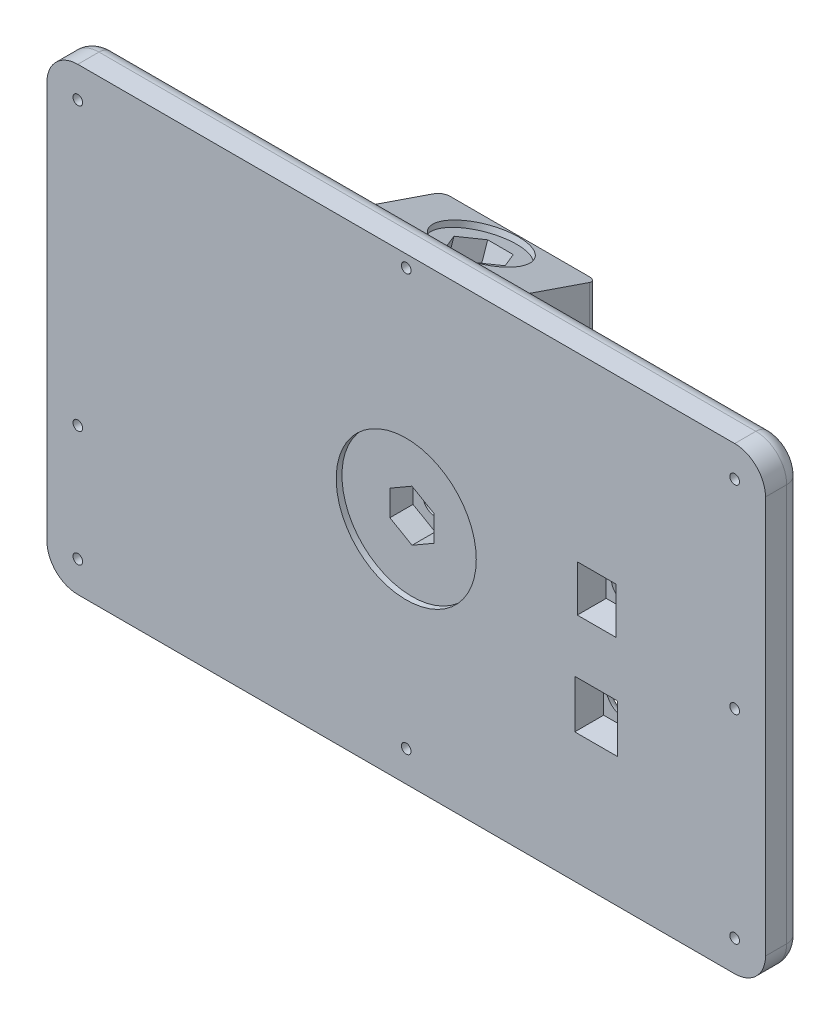
from build123d import *

# Parameters (mm, degrees)
SKETCH1_R            = 1.25
SKETCH1_W            = 156.43
SKETCH1_H            = 89.15
SKETCH1_W_2          = 17.19
SKETCH1_H_2          = 1
SKETCH1_H_3          = 0.5
SKETCH1_W_3          = 1
SKETCH1_H_4          = 11.97
SKETCH1_W_4          = 0.5
SKETCH1_W_5          = 2
BOSS_EXTRUDE3_DEPTH  = 9.5
FILLET2_R            = 4
SKETCH9_R            = 5.06
CUT_EXTRUDE5_DEPTH   = 118.948373888
SKETCH9_3_W          = 11.15
SKETCH9_3_H          = 12.5
CUT_EXTRUDE6_DEPTH   = 7.5
SKETCH10_R           = 3.69
SKETCH10_R_2         = 3.19
CUT_EXTRUDE7_DEPTH   = 118.948373888
SKETCH10_3_W         = 10.01
SKETCH10_3_H         = 11.98
SKETCH10_3_W_2       = 9.01
SKETCH10_3_H_2       = 10.98
SKETCH10_3_R         = 3.69
CUT_EXTRUDE8_DEPTH   = 7.5
FILLET3_R            = 2
SKETCH12_R           = 3.175
CUT_EXTRUDE9_DEPTH   = 118.948373888
SKETCH12_3_R         = 3.175
CUT_EXTRUDE10_DEPTH  = 7.5
SKETCH12_4_R         = 18.175
CUT_EXTRUDE11_DEPTH  = 1.5
SKETCH13_W           = 40
SKETCH13_H           = 25
BOSS_EXTRUDE10_DEPTH = 20
CUT_EXTRUDE12_DEPTH  = 132.946470296
SKETCH15_R           = 10.175
SKETCH15_R_2         = 3.175
CUT_EXTRUDE13_DEPTH  = 1.5
CUT_EXTRUDE14_START  = -1.5
SKETCH15_3_R         = 3.175
CUT_EXTRUDE14_DEPTH  = 6
CUT_EXTRUDE15_START  = -7.5
SKETCH15_5_R         = 3.175
CUT_EXTRUDE15_DEPTH  = 4
SKETCH16_R           = 1.25
CUT_EXTRUDE16_DEPTH  = 122.209813559
FILLET4_R            = 2


# Some blends are built 0.0001 mm under size
with BuildPart() as part:
    # Sketch1 → Boss-Extrude3 (new body)
    # profile 1 of 11: a face of its own
    with BuildSketch(Plane.XY):
        with BuildLine():
            ThreePointArc((-90.129170507, 54.402530662), (-95.786024756, 52.059384912), (-98.129170507, 46.402530662))
            Line((-98.129170507, 46.402530662), (-98.129170507, -56.747469338))
            ThreePointArc((-98.129170507, -56.747469338), (-95.786024756, -62.404323587), (-90.129170507, -64.747469338))
            Line((-90.129170507, -64.747469338), (80.300829493, -64.747469338))
            ThreePointArc((80.300829493, -64.747469338), (85.957683743, -62.404323587), (88.300829493, -56.747469338))
            Line((88.300829493, -56.747469338), (88.300829493, 46.402530662))
            ThreePointArc((88.300829493, 46.402530662), (85.957683743, 52.059384912), (80.300829493, 54.402530662))
            Line((80.300829493, 54.402530662), (-90.129170507, 54.402530662))
        make_face()
        with Locations((-90.129170507, -56.747469338)):
            Circle(SKETCH1_R, mode=Mode.SUBTRACT)
        with Locations((80.300829493, -56.747469338)):
            Circle(SKETCH1_R, mode=Mode.SUBTRACT)
        with BuildLine():
            Line((-89.239170507, -53.907469338), (-89.239170507, 45.524806332))
            ThreePointArc((-89.239170507, 45.524806332), (-91.378326538, 46.448456797), (-89.177120088, 47.212530662))
            Line((-89.177120088, 47.212530662), (-38.909170507, 47.212530662))
            Line((-38.909170507, 47.212530662), (-38.909170507, 48.212530662))
            Line((-38.909170507, 48.212530662), (-21.719170507, 48.212530662))
            Line((-21.719170507, 48.212530662), (-21.719170507, 47.212530662))
            Line((-21.719170507, 47.212530662), (76.680829493, 47.212530662))
            Line((76.680829493, 47.212530662), (76.680829493, -0.147469338))
            Line((76.680829493, -0.147469338), (77.680829493, -0.147469338))
            Line((77.680829493, -0.147469338), (77.680829493, -12.117469338))
            Line((77.680829493, -12.117469338), (76.680829493, -12.117469338))
            Line((76.680829493, -12.117469338), (76.680829493, -53.907469338))
            Line((76.680829493, -53.907469338), (-89.239170507, -53.907469338))
        make_face(mode=Mode.SUBTRACT)
        with Locations((80.300829493, 46.402530662)):
            Circle(SKETCH1_R, mode=Mode.SUBTRACT)
    # profile 2 of 11: a face of its own
    with BuildSketch(Plane.XY):
        with BuildLine():
            ThreePointArc((-88.879170507, 46.402530662), (-88.972667156, 45.928189013), (-89.239170507, 45.524806332))
            Line((-89.239170507, 45.524806332), (-89.239170507, -53.907469338))
            Line((-89.239170507, -53.907469338), (76.680829493, -53.907469338))
            Line((76.680829493, -53.907469338), (76.680829493, -12.117469338))
            Line((76.680829493, -12.117469338), (76.180829493, -12.117469338))
            Line((76.180829493, -12.117469338), (76.180829493, -53.407469338))
            Line((76.180829493, -53.407469338), (-88.739170507, -53.407469338))
            Line((-88.739170507, -53.407469338), (-88.739170507, 46.712530662))
            Line((-88.739170507, 46.712530662), (-38.909170507, 46.712530662))
            Line((-38.909170507, 46.712530662), (-38.909170507, 47.212530662))
            Line((-38.909170507, 47.212530662), (-89.177120088, 47.212530662))
            ThreePointArc((-89.177120088, 47.212530662), (-88.956020256, 46.834061065), (-88.879170507, 46.402530662))
        make_face()
    # profile 3 of 11: a face of its own
    with BuildSketch(Plane.XY):
        Polygon((-38.909170507, 46.212530662), (-38.909170507, 46.712530662), (-88.739170507, 46.712530662), (-88.739170507, -53.407469338), (76.180829493, -53.407469338), (76.180829493, -12.117469338), (74.180829493, -12.117469338), (74.180829493, -0.147469338), (76.180829493, -0.147469338), (76.180829493, 46.712530662), (-21.719170507, 46.712530662), (-21.719170507, 46.212530662), align=None)
        with Locations((-4.914170507, -5.172469338)):
            Rectangle(SKETCH1_W, SKETCH1_H, mode=Mode.SUBTRACT)
    # profile 4 of 11: a face of its own
    with BuildSketch(Plane.XY):
        with Locations((-4.914170507, -5.172469338)):
            Rectangle(SKETCH1_W, SKETCH1_H)
    # profile 5 of 11: a face of its own
    with BuildSketch(Plane.XY):
        Polygon((76.680829493, 47.212530662), (-21.719170507, 47.212530662), (-21.719170507, 46.712530662), (76.180829493, 46.712530662), (76.180829493, -0.147469338), (76.680829493, -0.147469338), align=None)
    # profile 6 of 11: a face of its own
    with BuildSketch(Plane.XY):
        with Locations((-30.314170507, 47.712530662)):
            Rectangle(SKETCH1_W_2, SKETCH1_H_2)
    # profile 7 of 11: a face of its own
    with BuildSketch(Plane.XY):
        with Locations((-30.314170507, 46.962530662)):
            Rectangle(SKETCH1_W_2, SKETCH1_H_3)
    # profile 8 of 11: a face of its own
    with BuildSketch(Plane.XY):
        with Locations((-30.314170507, 46.462530662)):
            Rectangle(SKETCH1_W_2, SKETCH1_H_3)
    # profile 9 of 11: a face of its own
    with BuildSketch(Plane.XY):
        with Locations((77.180829493, -6.132469338)):
            Rectangle(SKETCH1_W_3, SKETCH1_H_4)
    # profile 10 of 11: a face of its own
    with BuildSketch(Plane.XY):
        with Locations((76.430829493, -6.132469338)):
            Rectangle(SKETCH1_W_4, SKETCH1_H_4)
    # profile 11 of 11: a face of its own
    with BuildSketch(Plane.XY):
        with Locations((75.180829493, -6.132469338)):
            Rectangle(SKETCH1_W_5, SKETCH1_H_4)
    extrude(amount=BOSS_EXTRUDE3_DEPTH)

    # Fillet2
    fillet2_edges = [part.edges().sort_by_distance(p)[0] for p in [
        (88.300829493, -5.172469338, 0),
        (85.957683743, -62.404323587, 0),
        (-4.914170507, -64.747469338, 0),
        (-95.786024756, -62.404323587, 0),
        (-98.129170507, -5.172469338, 0),
        (-95.786024756, 52.059384912, 0),
        (-4.914170507, 54.402530662, 0),
        (85.957683743, 52.059384912, 0),
    ]]
    fillet(fillet2_edges, radius=FILLET2_R)

    # Sketch9 → Cut-Extrude5 (cut, through all)
    with BuildSketch(Plane.XY.offset(9.5)):
        with Locations((44.372859259, -24.18936125)):
            Circle(SKETCH9_R)
    extrude(amount=-CUT_EXTRUDE5_DEPTH, mode=Mode.SUBTRACT)

    # Sketch9<3> → Cut-Extrude6 (cut)
    with BuildSketch(Plane.XY.offset(9.5)):
        with Locations((44.387859259, -24.87936125)):
            Rectangle(SKETCH9_3_W, SKETCH9_3_H)
    extrude(amount=-CUT_EXTRUDE6_DEPTH, mode=Mode.SUBTRACT)

    # Sketch10 → Cut-Extrude7 (cut, through all)
    # profile 1 of 2: a face of its own
    with BuildSketch(Plane.XY.offset(9.5)):
        with Locations((44.481193334, 0.485874053)):
            Circle(SKETCH10_R)
        with Locations((44.481193334, 0.485874053)):
            Circle(SKETCH10_R_2, mode=Mode.SUBTRACT)
    # profile 2 of 2: a face of its own
    with BuildSketch(Plane.XY.offset(9.5)):
        with Locations((44.481193334, 0.485874053)):
            Circle(SKETCH10_R_2)
    extrude(amount=-CUT_EXTRUDE7_DEPTH, mode=Mode.SUBTRACT)

    # Sketch10<3> → Cut-Extrude8 (cut)
    # profile 1 of 2: a face of its own
    with BuildSketch(Plane.XY.offset(9.5)):
        with Locations((44.481193334, 1.435874053)):
            Rectangle(SKETCH10_3_W, SKETCH10_3_H)
        with Locations((44.481193334, 1.435874053)):
            Rectangle(SKETCH10_3_W_2, SKETCH10_3_H_2, mode=Mode.SUBTRACT)
    # profile 2 of 2: a face of its own
    with BuildSketch(Plane.XY.offset(9.5)):
        with Locations((44.481193334, 1.435874053)):
            Rectangle(SKETCH10_3_W_2, SKETCH10_3_H_2)
        with Locations((44.481193334, 0.485874053)):
            Circle(SKETCH10_3_R, mode=Mode.SUBTRACT)
    extrude(amount=-CUT_EXTRUDE8_DEPTH, mode=Mode.SUBTRACT)

    # Fillet3
    fillet3_edges = [part.edges().sort_by_distance(p)[0] for p in [
        (39.312859259, -24.18936125, 0),
        (40.791193334, 0.485874053, 0),
    ]]
    fillet(fillet3_edges, radius=FILLET3_R - 0.0001)  # a hair under: the kernel refuses the full size

    # Sketch12 → Cut-Extrude9 (cut, through all)
    with BuildSketch(Plane.XY.offset(9.5)):
        with Locations((-4.914170507, -5.172469338)):
            Circle(SKETCH12_R)
    extrude(amount=-CUT_EXTRUDE9_DEPTH, mode=Mode.SUBTRACT)

    # Sketch12<3> → Cut-Extrude10 (cut)
    # profile 1 of 2: a face of its own
    with BuildSketch(Plane.XY.offset(9.5)):
        Polygon((-10.653266544, -8.499551645), (-4.902380726, -11.806213454), (0.83671531, -8.479131146), (0.82492553, -1.84538703), (-4.925960287, 1.461274779), (-10.665056324, -1.865807529), align=None)
        Polygon((-4.902893772, -11.517538775), (0.586459182, -8.335238117), (0.575182447, -1.990168679), (-4.925447242, 1.1726001), (-10.414800196, -2.009700558), (-10.403523461, -8.354769996), align=None, mode=Mode.SUBTRACT)
    # profile 2 of 2: a face of its own
    with BuildSketch(Plane.XY.offset(9.5)):
        Polygon((-10.403523461, -8.354769996), (-4.902893772, -11.517538775), (0.586459182, -8.335238117), (0.575182447, -1.990168679), (-4.925447242, 1.1726001), (-10.414800196, -2.009700558), align=None)
        with Locations((-4.914170507, -5.172469338)):
            Circle(SKETCH12_3_R, mode=Mode.SUBTRACT)
    extrude(amount=-CUT_EXTRUDE10_DEPTH, mode=Mode.SUBTRACT)

    # Sketch12<4> → Cut-Extrude11 (cut)
    with BuildSketch(Plane.XY.offset(9.5)):
        with Locations((-4.914170507, -5.172469338)):
            Circle(SKETCH12_4_R)
        Polygon((-4.902380726, -11.806213454), (0.83671531, -8.479131146), (0.82492553, -1.84538703), (-4.925960287, 1.461274779), (-10.665056324, -1.865807529), (-10.653266544, -8.499551645), align=None, mode=Mode.SUBTRACT)
    extrude(amount=-CUT_EXTRUDE11_DEPTH, mode=Mode.SUBTRACT)

    # Sketch13 → Boss-Extrude10 (add)
    with BuildSketch(Plane(origin=(0, 0, 0), x_dir=(-1, 0, 0), z_dir=(0, 0, -1))):
        with Locations((4.914170507, 37.902530662)):
            Rectangle(SKETCH13_W, SKETCH13_H)
    extrude(amount=BOSS_EXTRUDE10_DEPTH)

    # Sketch14 → Cut-Extrude12 (cut, through all)
    with BuildSketch(Plane(origin=(15.085829493, 0, 0), x_dir=(0, 0, -1), z_dir=(1, 0, 0))):
        Polygon((0, 50.402530662), (20, 43.542404813), (20, 50.402530662), align=None)
    extrude(amount=-CUT_EXTRUDE12_DEPTH, mode=Mode.SUBTRACT)

    # Sketch15 → Cut-Extrude13 (cut)
    # profile 1 of 4: a face of its own
    with BuildSketch(Plane(origin=(0, 45.096748617, -15.468468545), x_dir=(1, 0, 0), z_dir=(0, 0.9459026548151281, -0.32445056266508826))):
        with Locations(Location((-4.914170507, -5.779304645, 0), (0, 0, 270))):
            Circle(SKETCH15_R)
        Polygon((-1.594406459, -11.529304645), (1.725357589, -5.779304645), (-1.594406459, -0.029304645), (-8.233934555, -0.029304645), (-11.553698603, -5.779304645), (-8.233934555, -11.529304645), align=None, mode=Mode.SUBTRACT)
    # profile 2 of 4: a face of its own
    with BuildSketch(Plane(origin=(0, 45.096748617, -15.468468545), x_dir=(1, 0, 0), z_dir=(0, 0.9459026548151281, -0.32445056266508826))):
        Polygon((-8.233934555, -11.529304645), (-1.594406459, -11.529304645), (1.725357589, -5.779304645), (-1.594406459, -0.029304645), (-8.233934555, -0.029304645), (-11.553698603, -5.779304645), align=None)
        Polygon((-1.738744026, -11.279304645), (1.436682454, -5.779304645), (-1.738744026, -0.279304645), (-8.089596987, -0.279304645), (-11.265023468, -5.779304645), (-8.089596987, -11.279304645), align=None, mode=Mode.SUBTRACT)
    # profile 3 of 4: a face of its own
    with BuildSketch(Plane(origin=(0, 45.096748617, -15.468468545), x_dir=(1, 0, 0), z_dir=(0, 0.9459026548151281, -0.32445056266508826))):
        Polygon((-8.089596987, -11.279304645), (-1.738744026, -11.279304645), (1.436682454, -5.779304645), (-1.738744026, -0.279304645), (-8.089596987, -0.279304645), (-11.265023468, -5.779304645), align=None)
        with Locations((-4.914170507, -5.779304645)):
            Circle(SKETCH15_R_2, mode=Mode.SUBTRACT)
    # profile 4 of 4: a face of its own
    with BuildSketch(Plane(origin=(0, 45.096748617, -15.468468545), x_dir=(1, 0, 0), z_dir=(0, 0.9459026548151281, -0.32445056266508826))):
        with Locations((-4.914170507, -5.779304645)):
            Circle(SKETCH15_R_2)
    extrude(amount=-CUT_EXTRUDE13_DEPTH, mode=Mode.SUBTRACT)

    # Sketch15<3> → Cut-Extrude14 (cut)
    # profile 1 of 3: a face of its own
    with BuildSketch(Plane(origin=(0, 45.096748617, -15.468468545), x_dir=(1, 0, 0), z_dir=(0, 0.9459026548151281, -0.32445056266508826)).offset(CUT_EXTRUDE14_START)):
        Polygon((-8.233934555, -11.529304645), (-1.594406459, -11.529304645), (1.725357589, -5.779304645), (-1.594406459, -0.029304645), (-8.233934555, -0.029304645), (-11.553698603, -5.779304645), align=None)
        Polygon((-1.738744026, -11.279304645), (1.436682454, -5.779304645), (-1.738744026, -0.279304645), (-8.089596987, -0.279304645), (-11.265023468, -5.779304645), (-8.089596987, -11.279304645), align=None, mode=Mode.SUBTRACT)
    # profile 2 of 3: a face of its own
    with BuildSketch(Plane(origin=(0, 45.096748617, -15.468468545), x_dir=(1, 0, 0), z_dir=(0, 0.9459026548151281, -0.32445056266508826)).offset(CUT_EXTRUDE14_START)):
        Polygon((-8.089596987, -11.279304645), (-1.738744026, -11.279304645), (1.436682454, -5.779304645), (-1.738744026, -0.279304645), (-8.089596987, -0.279304645), (-11.265023468, -5.779304645), align=None)
        with Locations((-4.914170507, -5.779304645)):
            Circle(SKETCH15_3_R, mode=Mode.SUBTRACT)
    # profile 3 of 3: a face of its own
    with BuildSketch(Plane(origin=(0, 45.096748617, -15.468468545), x_dir=(1, 0, 0), z_dir=(0, 0.9459026548151281, -0.32445056266508826)).offset(CUT_EXTRUDE14_START)):
        with Locations((-4.914170507, -5.779304645)):
            Circle(SKETCH15_3_R)
    extrude(amount=-CUT_EXTRUDE14_DEPTH, mode=Mode.SUBTRACT)

    # Sketch15<5> → Cut-Extrude15 (cut)
    with BuildSketch(Plane(origin=(0, 45.096748617, -15.468468545), x_dir=(1, 0, 0), z_dir=(0, 0.9459026548151281, -0.32445056266508826)).offset(CUT_EXTRUDE15_START)):
        with Locations(Location((-4.914170507, -5.779304645, 0), (0, 0, 270))):
            Circle(SKETCH15_5_R)
    extrude(amount=-CUT_EXTRUDE15_DEPTH, mode=Mode.SUBTRACT)

    # Sketch16 → Cut-Extrude16 (cut, through all)
    with BuildSketch(Plane.XY.offset(9.5)):
        with Locations((-4.914170507, -56.747469338)):
            Circle(SKETCH16_R)
        with Locations((80.300829493, -5.172469338)):
            Circle(SKETCH16_R)
        with Locations((-4.914170507, 51.252530662)):
            Circle(SKETCH16_R)
        with Locations((-90.129170507, -26.747469338)):
            Circle(SKETCH16_R)
    extrude(amount=-CUT_EXTRUDE16_DEPTH, mode=Mode.SUBTRACT)

    # Fillet4
    # the kernel refuses this fillet: 2 mm, written as the material it takes off along each edge
    with BuildSketch(Plane(origin=(-22.914170507, 27.402530662, -18), x_dir=(0, -1, 0), z_dir=(0, 0, -1))) as fillet4_piece_1_section:
        Polygon((0, 0), (FILLET4_R, 0), (FILLET4_R, FILLET4_R), (0, FILLET4_R), align=None)
    fillet4_piece_1 = extrude(amount=FILLET4_R, mode=Mode.PRIVATE)
    fillet4_piece_1 = fillet4_piece_1 - Plane(origin=(-22.914170507, 27.402530662, -18), x_dir=(0.7071067811865476, 0.7071067811865474, 0), z_dir=(0, 0, -1)) * Sphere(FILLET4_R, mode=Mode.PRIVATE)
    add(fillet4_piece_1, mode=Mode.SUBTRACT)
    with BuildSketch(Plane(origin=(13.085829493, 27.402530662, -18), x_dir=(1, 0, 0), z_dir=(0, 0, -1))) as fillet4_piece_2_section:
        Polygon((0, 0), (FILLET4_R, 0), (FILLET4_R, FILLET4_R), (0, FILLET4_R), align=None)
    fillet4_piece_2 = extrude(amount=FILLET4_R, mode=Mode.PRIVATE)
    fillet4_piece_2 = fillet4_piece_2 - Plane(origin=(13.085829493, 27.402530662, -18), x_dir=(-0.7071067811865475, 0.7071067811865475, 0), z_dir=(0, 0, -1)) * Sphere(FILLET4_R, mode=Mode.PRIVATE)
    add(fillet4_piece_2, mode=Mode.SUBTRACT)
    with BuildSketch(Plane(origin=(-24.914170507, 25.402530662, 0), x_dir=(1, 0, 0), z_dir=(0, 0, -1)), Plane(origin=(15.085829493, 25.402530662, 0), x_dir=(0, 1, 0), z_dir=(0, 0, -1))) as fillet4_piece_3:
        with BuildLine():
            CenterArc((FILLET4_R, -FILLET4_R), FILLET4_R, 90, 90)
            Line((0, -FILLET4_R), (0, 0))
            Line((0, 0), (FILLET4_R, 0))
        make_face()
    extrude(amount=18, mode=Mode.SUBTRACT)
    with BuildSketch(Plane(origin=(-24.914170507, 48.542404813, -20), x_dir=(0, 0, 1), z_dir=(0, -1, 0)), Plane(origin=(15.085829493, 27.402530662, -20), x_dir=(0, 0, 1), z_dir=(0, 1, 0))) as fillet4_piece_4:
        with BuildLine():
            CenterArc((FILLET4_R, -FILLET4_R), FILLET4_R, 90, 90)
            Line((0, -FILLET4_R), (0, 0))
            Line((0, 0), (FILLET4_R, 0))
        make_face()
    extrude(amount=21.139874151, mode=Mode.SUBTRACT)
    with BuildSketch(Plane(origin=(-22.914170507, 25.402530662, -20), x_dir=(0, 0, 1), z_dir=(1, 0, 0))) as fillet4_piece_5:
        with BuildLine():
            CenterArc((FILLET4_R, -FILLET4_R), FILLET4_R, 90, 90)
            Line((0, -FILLET4_R), (0, 0))
            Line((0, 0), (FILLET4_R, 0))
        make_face()
    extrude(amount=36, mode=Mode.SUBTRACT)
    # the kernel refuses this fillet: 2 mm, written as the material it adds along each edge
    with BuildSketch(Plane(origin=(-24.914170507, 55.402530662, 0), x_dir=(-1, 0, 0), z_dir=(0, -1, 0))) as fillet4_2_piece_1_section:
        with BuildLine():
            CenterArc((FILLET4_R, FILLET4_R), FILLET4_R, 180, 90)
            Line((0, FILLET4_R), (0, 0))
            Line((0, 0), (FILLET4_R, 0))
        make_face()
    fillet4_2_piece_1 = extrude(amount=28, mode=Mode.PRIVATE)
    fillet4_2_piece_1 = split(fillet4_2_piece_1, bisect_by=Plane(origin=(-25.368609753, 49.045718482, -3.955648076), z_dir=(0, -0.9459026548151283, 0.3244505626650883)), keep=Keep.TOP, mode=Mode.PRIVATE)
    add(fillet4_2_piece_1)
    with BuildSketch(Plane(origin=(15.085829493, 27.402530662, 0), x_dir=(1, 0, 0), z_dir=(0, 1, 0))) as fillet4_2_piece_2_section:
        with BuildLine():
            CenterArc((FILLET4_R, FILLET4_R), FILLET4_R, 180, 90)
            Line((0, FILLET4_R), (0, 0))
            Line((0, 0), (FILLET4_R, 0))
        make_face()
    fillet4_2_piece_2 = extrude(amount=28, mode=Mode.PRIVATE)
    fillet4_2_piece_2 = split(fillet4_2_piece_2, bisect_by=Plane(origin=(15.540268739, 49.045718482, -3.955648076), z_dir=(0, -0.9459026548151283, 0.3244505626650883)), keep=Keep.TOP, mode=Mode.PRIVATE)
    add(fillet4_2_piece_2)
    with BuildSketch(Plane(origin=(-22.914170507, 25.402530662, 0), x_dir=(0, -1, 0), z_dir=(1, 0, 0))) as fillet4_2_piece_3:
        with BuildLine():
            CenterArc((FILLET4_R, FILLET4_R), FILLET4_R, 180, 90)
            Line((0, FILLET4_R), (0, 0))
            Line((0, 0), (FILLET4_R, 0))
        make_face()
    extrude(amount=36)
    with BuildSketch(Plane(origin=(-22.914170507, 27.402530662, 0), x_dir=(0, -1, 0), z_dir=(1, 0, 0))) as fillet4_2_piece_4:
        with BuildLine():
            CenterArc((2 + FILLET4_R, FILLET4_R), FILLET4_R, 180, 90)
            Line((2, FILLET4_R), (2, 0))
            Line((2, 0), (2 + FILLET4_R, 0))
        make_face()
    revolve(axis=Axis((-22.914170507, 27.402530662, 0), (0, 0, -1)), revolution_arc=90)
    with BuildSketch(Plane(origin=(13.085829493, 27.402530662, 0), x_dir=(1, 0, 0), z_dir=(0, 1, 0))) as fillet4_2_piece_5:
        with BuildLine():
            CenterArc((2 + FILLET4_R, FILLET4_R), FILLET4_R, 180, 90)
            Line((2, FILLET4_R), (2, 0))
            Line((2, 0), (2 + FILLET4_R, 0))
        make_face()
    revolve(axis=Axis((13.085829493, 27.402530662, 0), (0, 0, -1)), revolution_arc=90)


solid = part.part
